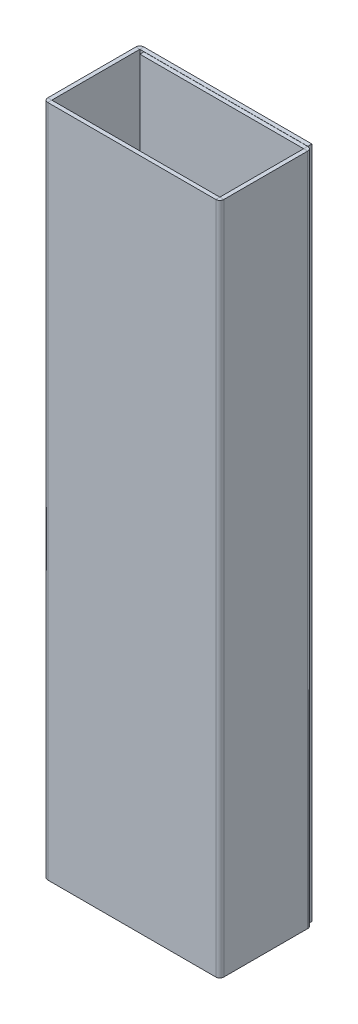
from build123d import *

# Parameters (mm, degrees)
FLANGE_BASE1_DEPTH = 40


# Sheet-metal steps are written as plain solids
with BuildPart() as part:
    # Esboço1 → Flange-base1 (new body)
    with BuildSketch(Plane(origin=(0, 0, 0), x_dir=(1, 0, 0), z_dir=(0, 1, 0))):
        with BuildLine():
            Line((4.99, 2.615), (-4.989, 2.615))
            ThreePointArc((-4.989, 2.615), (-4.989707107, 2.614707107), (-4.99, 2.614))
            Line((-4.99, 2.614), (-4.99, -2.614))
            ThreePointArc((-4.99, -2.614), (-4.989707107, -2.614707107), (-4.989, -2.615))
            Line((-4.989, -2.615), (4.989, -2.615))
            ThreePointArc((4.989, -2.615), (4.989707107, -2.614707107), (4.99, -2.614))
            Line((4.99, -2.614), (4.99, 2.364))
            ThreePointArc((4.99, 2.364), (4.989707107, 2.364707107), (4.989, 2.365))
            Line((4.989, 2.365), (-4.74, 2.365))
            Line((-4.74, 2.365), (-4.74, 2.605))
            Line((-4.74, 2.605), (4.989, 2.605))
            ThreePointArc((4.989, 2.605), (5.159412734, 2.534412734), (5.23, 2.364))
            Line((5.23, 2.364), (5.23, -2.614))
            ThreePointArc((5.229999999, -2.614), (5.159412734, -2.784412735), (4.988999999, -2.855))
            Line((4.989, -2.855), (-4.989, -2.855))
            ThreePointArc((-4.988999999, -2.855), (-5.15941275, -2.784412718), (-5.23, -2.613999954))
            Line((-5.23, -2.613999954), (-5.23, 2.613998659))
            ThreePointArc((-5.23, 2.613998659), (-5.159413186, 2.784412283), (-4.988999936, 2.855))
            Line((-4.988999936, 2.855), (4.99, 2.855))
            Line((4.99, 2.855), (4.99, 2.615))
        make_face()
    extrude(amount=FLANGE_BASE1_DEPTH)


solid = part.part
